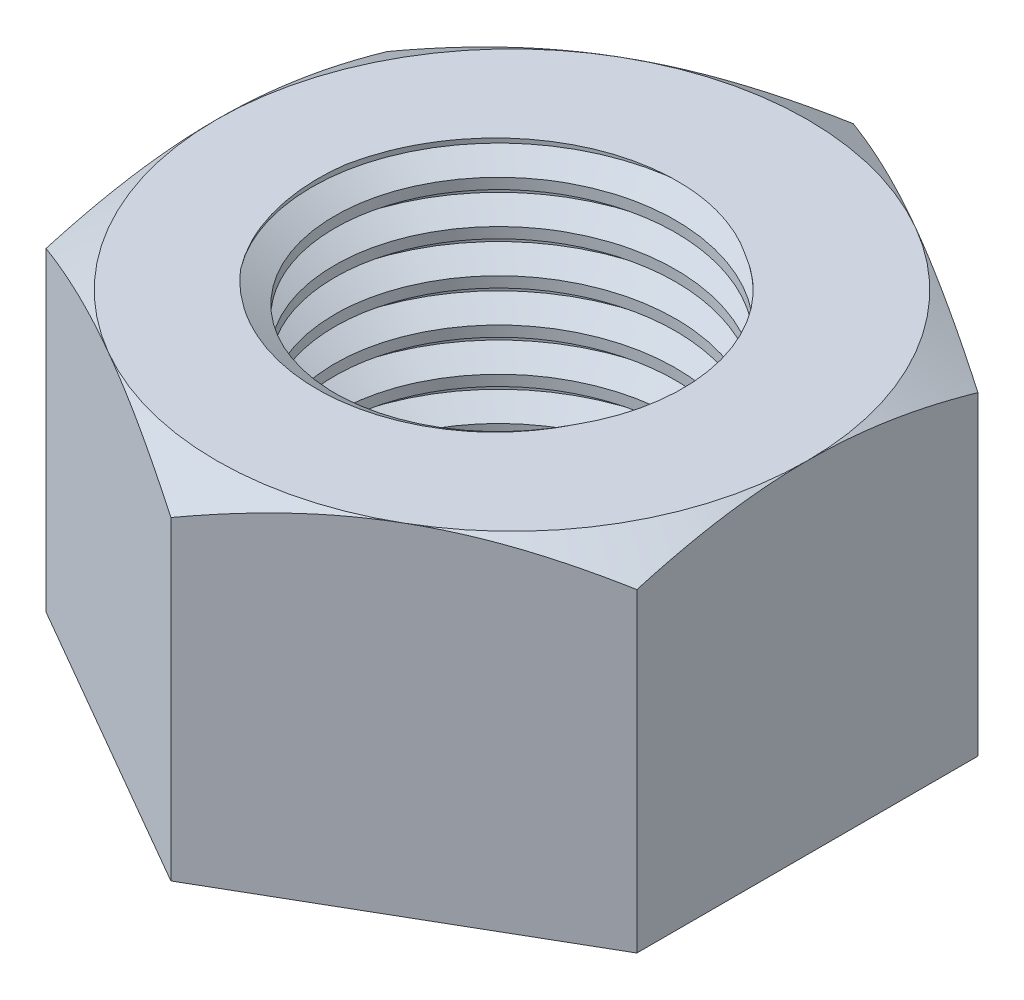
from build123d import *

# Parameters (mm, degrees)
BOSS_EXTRUDE1_DEPTH   = 24
F_1_0MM_DOWEL_HOLE2_D = 24
THREAD1_PITCH         = 3


with BuildPart() as part:
    # Sketch1 → Boss-Extrude1 (new body)
    with BuildSketch(Plane(origin=(0, 0, 0), x_dir=(1, 0, 0), z_dir=(0, 1, 0))):
        Polygon((0, -24), (20.784609691, -12), (20.784609691, 12), (0, 24), (-20.784609691, 12), (-20.784609691, -12), align=None)
    extrude(amount=BOSS_EXTRUDE1_DEPTH)

    # Ø1.0mm Dowel Hole2 (through all)
    with Locations(Plane(origin=(0, 24, 0), x_dir=(1, 0, 0), z_dir=(0, 1, 0))):
        with Locations((0, 0)):
            Hole(F_1_0MM_DOWEL_HOLE2_D / 2)

    # Thread1: the profile of Thread Profile1 profile screwed along a right-hand helix of 13.333333 turns, 10 arcs to a turn; built about Z, then put on its axis
    thread1_z = Axis((0, 0, 0), (0, 0, 1))
    thread1_corners = [(11.9997, 0, -0.000173205), (13.623797625, 0, 0.937499996), (13.623797625, 0, 1.312499996), (11.9997, 0, 2.250173197)]
    with BuildLine(mode=Mode.PRIVATE) as thread1_profile:
        Line(thread1_corners[0], thread1_corners[1])
        Line(thread1_corners[1], thread1_corners[2])
        Line(thread1_corners[2], thread1_corners[3])
        Line(thread1_corners[3], thread1_corners[0])
    thread1_cap = Face(thread1_profile.wire())
    thread1_turn_angles = [0, 18, 36, 54, 72, 90, 108, 126, 144, 162, 180, 198, 216, 234, 252, 270, 288, 306, 324, 342, 360]
    thread1_turn_weights = [1, 0.9510565162951535, 1, 0.9510565162951535, 1, 0.9510565162951535, 1, 0.9510565162951535, 1, 0.9510565162951535, 1, 0.9510565162951535, 1, 0.9510565162951535, 1, 0.9510565162951535, 1, 0.9510565162951535, 1, 0.9510565162951535, 1]
    thread1_turn_rails = [Edge.make_bspline([Vector(p[0], p[1], 0).rotate(thread1_z, thread1_turn_angles[k]) / thread1_turn_weights[k] + Vector(0, 0, p[2] + THREAD1_PITCH * thread1_turn_angles[k] / 360) for k in range(21)], [0, 0, 0, 1, 1, 2, 2, 3, 3, 4, 4, 5, 5, 6, 6, 7, 7, 8, 8, 9, 9, 10, 10, 10], 2, thread1_turn_weights) for p in thread1_corners]
    thread1_turn_sides = [Face.make_surface_from_curves(thread1_turn_rails[p[0]], thread1_turn_rails[p[1]]) for p in [(0, 1), (1, 2), (2, 3), (3, 0)]]
    thread1_last_angles = [4680, 4698, 4716, 4734, 4752, 4770, 4788, 4794, 4800]
    thread1_last_weights = [1, 0.9510565162951535, 1, 0.9510565162951535, 1, 0.9510565162951535, 1, 0.994521895368275, 1]
    thread1_last_rails = [Edge.make_bspline([Vector(p[0], p[1], 0).rotate(thread1_z, thread1_last_angles[k]) / thread1_last_weights[k] + Vector(0, 0, p[2] + THREAD1_PITCH * thread1_last_angles[k] / 360) for k in range(9)], [0, 0, 0, 1, 1, 2, 2, 3, 3, 4, 4, 4], 2, thread1_last_weights) for p in thread1_corners]
    thread1_last_sides = [Face.make_surface_from_curves(thread1_last_rails[p[0]], thread1_last_rails[p[1]]) for p in [(0, 1), (1, 2), (2, 3), (3, 0)]]
    thread1 = Plane(origin=(0, 34, 0), x_dir=(-1, 0, 0), z_dir=(0, -1, 0)) * Solid(Shell([*[p.moved(Location((0, 0, THREAD1_PITCH * i))) for i in range(13) for p in thread1_turn_sides], *thread1_last_sides, thread1_cap, thread1_cap.rotate(thread1_z, 4800).moved(Location((0, 0, THREAD1_PITCH * 4800 / 360)))]))
    add(thread1, mode=Mode.SUBTRACT)

    # Sketch13 → Cut-Revolve1 (revolve, cut)
    with BuildSketch(Plane(origin=(0, 0, 0), x_dir=(0.8660254037844345, 0, -0.5000000000000074), z_dir=(0.5000000000000073, 0, 0.8660254037844344))):
        Polygon((20.784609691, 24), (32.412647266, 24), (32.412647266, 17.286549376), align=None)
    revolve(axis=Axis((0, 24, 0), (0, -1, 0)), mode=Mode.SUBTRACT)


solid = part.part
